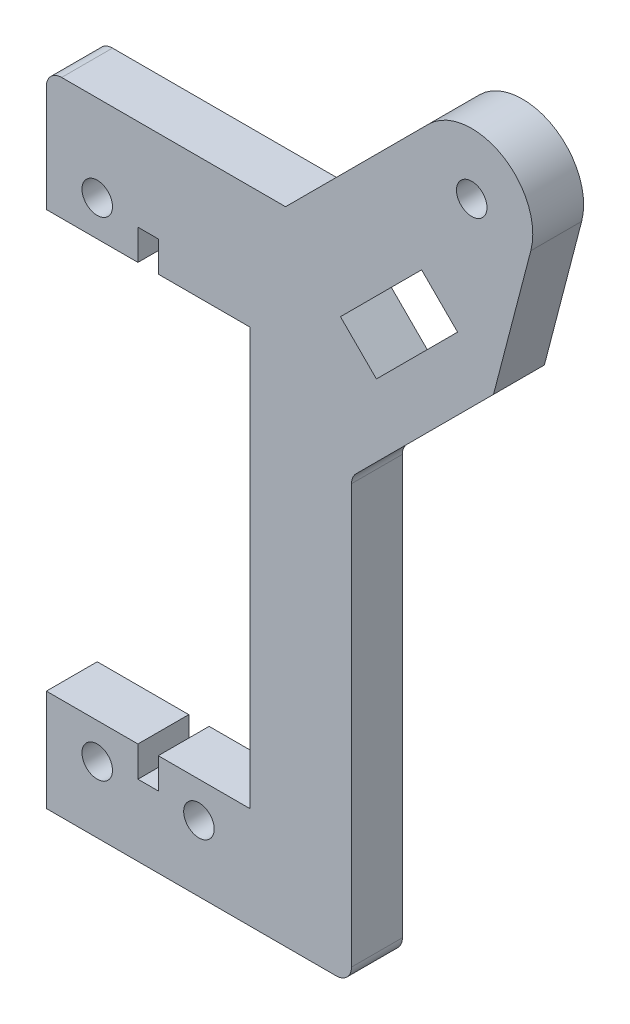
from build123d import *

# Parameters (mm, degrees)
ESQUISSE1_R        = 1.5
BOSS_EXTRU_1_DEPTH = 5
CONG_3_R           = 1.5


with BuildPart() as part:
    # Esquisse1 → Boss.-Extru.1 (new body)
    with BuildSketch(Plane.XY):
        with BuildLine():
            Line((9, 10), (0, 10))
            Line((0, 10), (0, 0))
            Line((0, 0), (30, 0))
            Line((30, 0), (30, 43.28152075))
            Line((30, 43.28152075), (43.961530357, 57.243051107))
            Line((43.961530357, 57.243051107), (47.625955008, 71.306985316))
            ThreePointArc((47.625955008, 71.306985316), (44.801829917, 78.026294211), (37.577164466, 77.06244584))
            Line((37.577164466, 77.06244584), (23.514718626, 63))
            Line((23.514718626, 63), (0, 63))
            Line((0, 63), (0, 51))
            Line((0, 51), (9, 51))
            Line((9, 51), (9, 54))
            Line((9, 54), (11, 54))
            Line((11, 54), (11, 51))
            Line((11, 51), (20, 51))
            Line((20, 51), (20, 10))
            Line((20, 10), (11, 10))
            Line((11, 10), (11, 7))
            Line((11, 7), (9, 7))
            Line((9, 7), (9, 10))
        make_face()
        with Locations((5, 6.5)):
            Circle(ESQUISSE1_R, mode=Mode.SUBTRACT)
        with Locations((15, 6.5)):
            Circle(ESQUISSE1_R, mode=Mode.SUBTRACT)
        with Locations((5, 54.5)):
            Circle(ESQUISSE1_R, mode=Mode.SUBTRACT)
        Polygon((28.912098666, 56.33575504), (36.890462545, 64.314118919), (40.425996451, 60.778585013), (32.447632572, 52.800221134), align=None, mode=Mode.SUBTRACT)
        with Locations((41.819805153, 72.819805153)):
            Circle(ESQUISSE1_R, mode=Mode.SUBTRACT)
    extrude(amount=BOSS_EXTRU_1_DEPTH)

    # Congé3
    cong_3_edges = [part.edges().sort_by_distance(p)[0] for p in [
        (0, 63, 2.5),
        (30, 0, 2.5),
        (30, 43.28152075, 2.5),
    ]]
    fillet(cong_3_edges, radius=CONG_3_R)


solid = part.part
